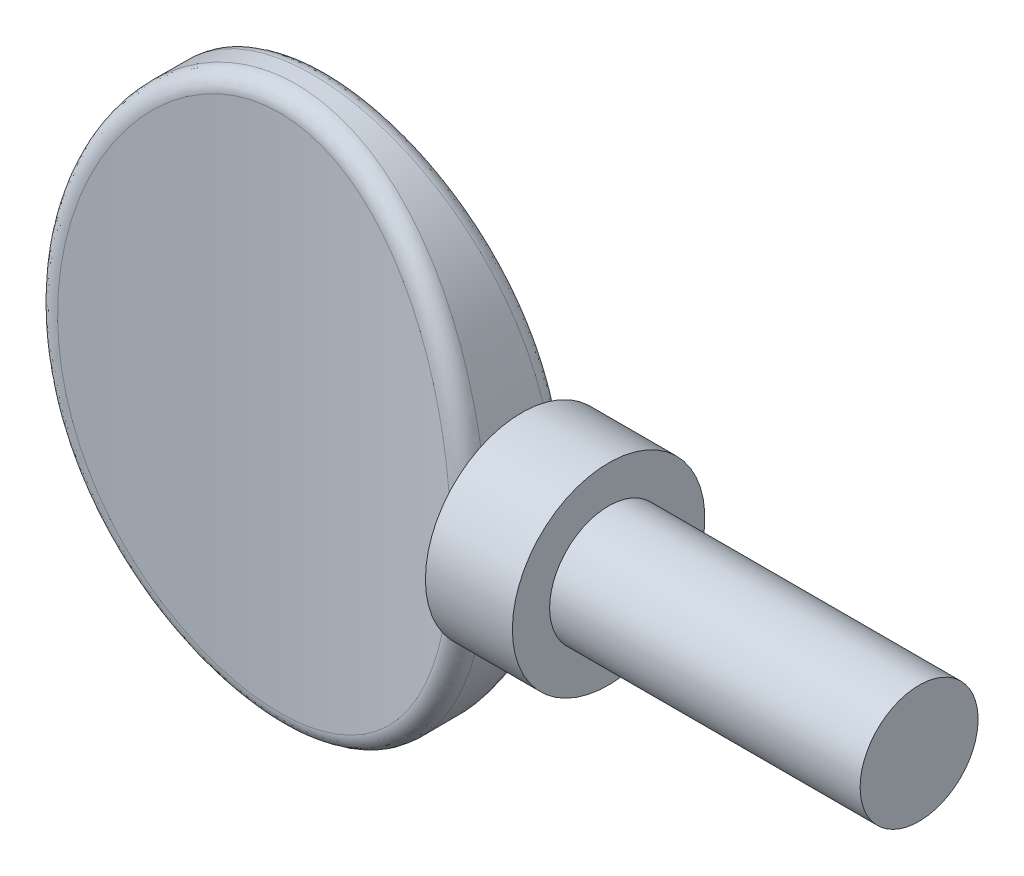
from build123d import *

# Parameters (mm, degrees)
SKETCH1_RX              = 11.303
SKETCH1_RY              = 8.889999999999999
EXTRUDE1_DEPTH          = 2.286
CUT_EXTRUDE1_DEPTH      = 15.560759080487529
CUT_EXTRUDE1_DEPTH_BACK = 15.560759080487529
SKETCH2_OUTSIDE_W       = 25.603999999999996
SKETCH2_OUTSIDE_H       = 12.396
FILLET3_R               = 0.6773333333333333


with BuildPart() as part:
    # Sketch1 → Extrude1 (new, symmetric)
    with BuildSketch(Plane.XY):
        with Locations(Location((0, 0), (0, 0, 90))):
            Ellipse(SKETCH1_RX, SKETCH1_RY)
    extrude(amount=EXTRUDE1_DEPTH, both=True)

    # Sketch2 outside → Cut-Extrude1 (cut, two sides: drawn at the far end of the back side and taken through both)
    with BuildSketch(Plane(origin=(0, 0, 0), x_dir=(1, 0, 0), z_dir=(0, 1, 0)).offset(-CUT_EXTRUDE1_DEPTH_BACK)):
        Rectangle(SKETCH2_OUTSIDE_W, SKETCH2_OUTSIDE_H)
        with BuildLine():
            Line((-8.889999999999999, 2.286), (-8.889999999999999, -2.286))
            ThreePointArc((-8.889999999999999, -2.286), (1.94e-15, -1.0159999999999982), (8.889999999999999, -2.286))
            Line((8.889999999999999, -2.286), (8.889999999999999, 2.286))
            ThreePointArc((8.889999999999999, 2.286), (1.94e-15, 1.0159999999999982), (-8.889999999999999, 2.286))
        make_face(mode=Mode.SUBTRACT)
    extrude(amount=CUT_EXTRUDE1_DEPTH + CUT_EXTRUDE1_DEPTH_BACK, mode=Mode.SUBTRACT)

    # Fillet3
    fillet3_edges = [part.edges().sort_by_distance(p)[0] for p in [
        (-6.499256061e-08, -11.302999999991183, 1.0159999999964504),
        (8.835220095e-08, -11.302999999991183, -1.0159999999964522),
    ]]
    fillet(fillet3_edges, radius=FILLET3_R)

    # Sketch3 → Revolve1 (revolve)
    with BuildSketch(Plane(origin=(0, 0, 0), x_dir=(1, 0, 0), z_dir=(0, 1, 0))):
        with BuildLine():
            Line((12.445999999999996, 3.9369999999999994), (12.445999999999996, 2.413))
            Line((12.445999999999996, 2.413), (25.145999999999994, 2.413))
            Line((25.145999999999994, 2.413), (25.145999999999994, 0))
            Line((25.145999999999994, 0), (7.236423048052516, 0))
            Line((7.236423048052516, 0), (7.236423048052516, 1.8516557328217895))
            ThreePointArc((7.236423048052516, 1.8516557328217895), (8.426438076724871, 2.6063068114075874), (8.889999999999999, 3.9370000000000003))
            Line((8.889999999999999, 3.9370000000000003), (12.445999999999996, 3.9369999999999994))
        make_face()
    revolve(axis=Axis((0, 0, 0), (1, 0, 0)))


solid = part.part
